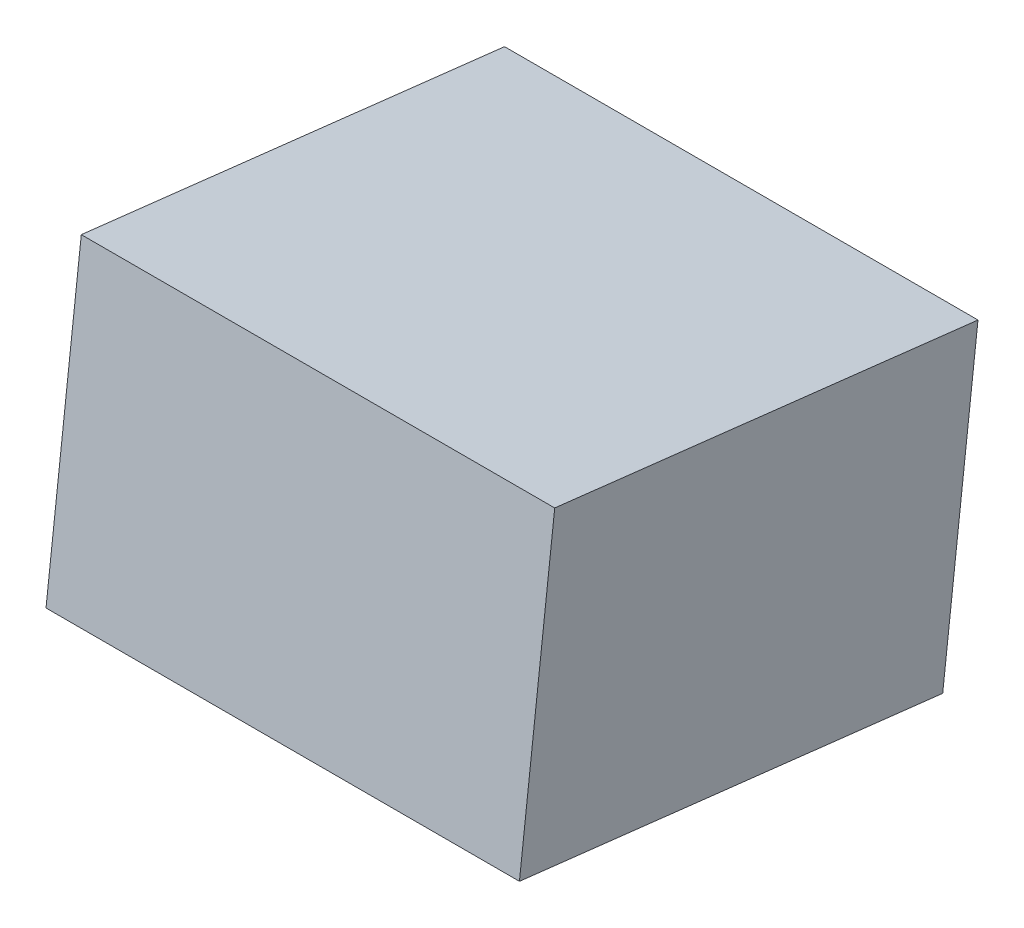
from build123d import *

# Parameters (mm, degrees)
SKETCH1_W           = 200
SKETCH1_H           = 180
BOSS_EXTRUDE1_DEPTH = 130


with BuildPart() as part:
    # Sketch1 → Boss-Extrude1 (new body)
    with BuildSketch(Plane(origin=(0, 343.978805368, -39.702551724), x_dir=(1, 0, 0), z_dir=(-6.8385480190203005e-15, 0.9934047622419532, -0.11466027365660884))):
        with Locations((-147.034475432, 965.52938032)):
            Rectangle(SKETCH1_W, SKETCH1_H)
    extrude(amount=BOSS_EXTRUDE1_DEPTH)


solid = part.part
